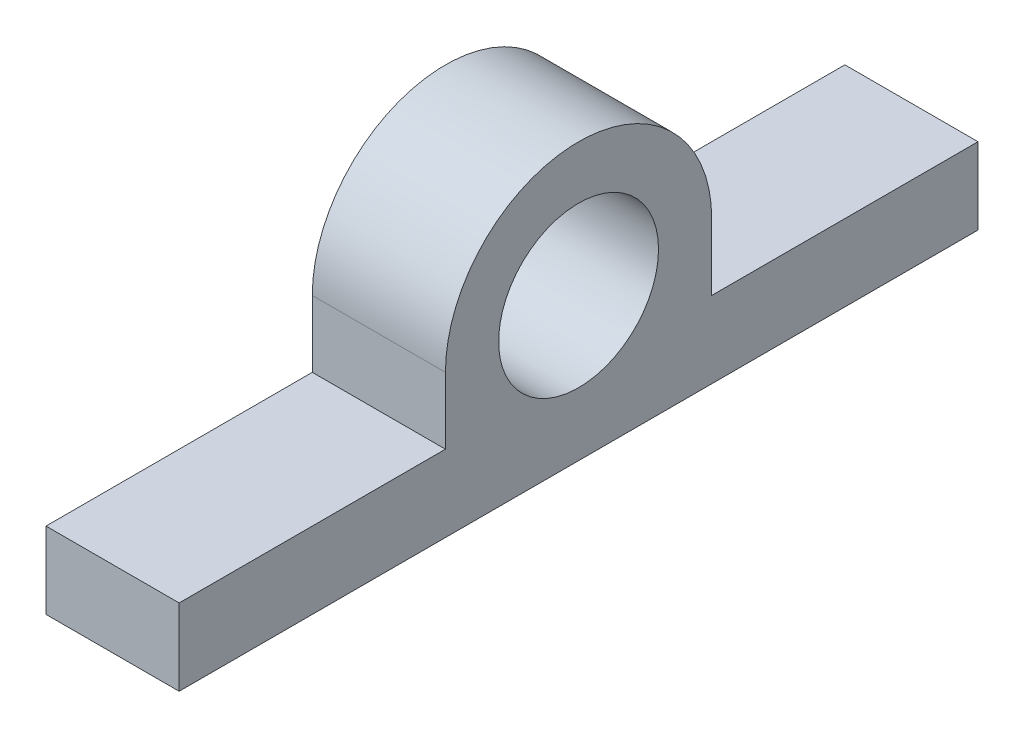
from build123d import *

# Parameters (mm, degrees)
BOSS_EXTRUDE1_DEPTH = 12.7
SKETCH2_R           = 7.62500004
CUT_EXTRUDE1_DEPTH  = 82.621397317
SKETCH3_R           = 2
CUT_EXTRUDE2_DEPTH  = 7


with BuildPart() as part:
    # Sketch1 → Boss-Extrude1 (new body)
    with BuildSketch(Plane(origin=(0, 0, 0), x_dir=(0, 0, -1), z_dir=(1, 0, 0))):
        with BuildLine():
            Line((0, 0), (76.2, 0))
            Line((76.2, 0), (76.2, 7.3))
            Line((76.2, 7.3), (50.8, 7.3))
            Line((50.8, 7.3), (50.8, 13.65))
            ThreePointArc((50.8, 13.65), (38.1, 26.35), (25.4, 13.65))
            Line((25.4, 13.65), (25.4, 7.3))
            Line((25.4, 7.3), (0, 7.3))
            Line((0, 7.3), (0, 0))
        make_face()
    extrude(amount=BOSS_EXTRUDE1_DEPTH)

    # Sketch2 → Cut-Extrude1 (cut, through all)
    with BuildSketch(Plane(origin=(12.7, 0, 0), x_dir=(0, 0, -1), z_dir=(1, 0, 0))):
        with Locations((38.1, 13.65)):
            Circle(SKETCH2_R)
    extrude(amount=-CUT_EXTRUDE1_DEPTH, mode=Mode.SUBTRACT)

    # Sketch3 → Cut-Extrude2 (cut)
    with BuildSketch(Plane.XZ):
        with Locations((6.35, -12.7)):
            Circle(SKETCH3_R)
        with Locations((6.35, -63.5)):
            Circle(SKETCH3_R)
    extrude(amount=-CUT_EXTRUDE2_DEPTH, mode=Mode.SUBTRACT)


solid = part.part
